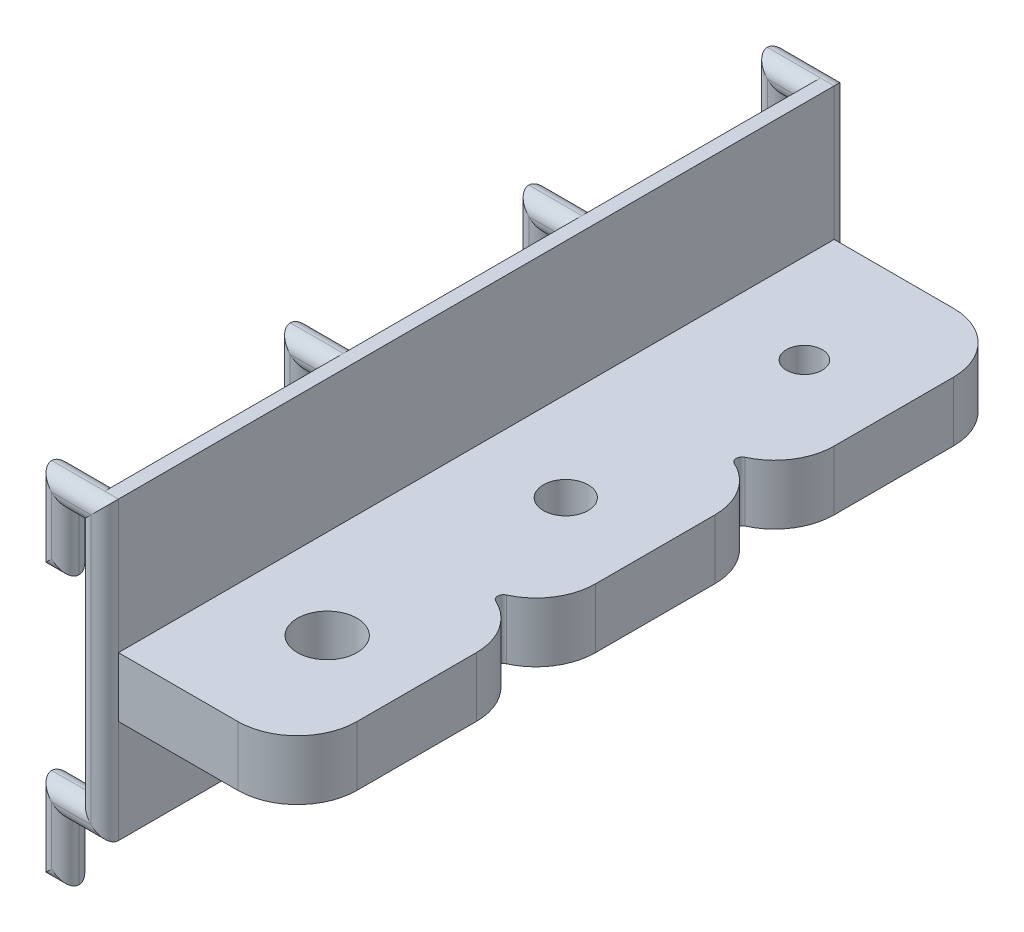
from build123d import *

# Parameters (mm, degrees)
EXTRU_MINCE1_DEPTH           = 2.3
CONG_1_R                     = 2.3
ESQUISSE2_W                  = 120
ESQUISSE2_H                  = 49.6
BOSS_EXTRU_1_DEPTH           = 2.3
R_P_TITION_START             = 117.7
R_P_TITION_LIN_AIRE1_DEPTH   = 4.6
R_P_TITION_START_2           = 37.7
R_P_TITION_LIN_AIRE1_2_DEPTH = 4.6
R_P_TITION_START_3           = 77.7
R_P_TITION_LIN_AIRE1_3_DEPTH = 4.6
CONG_2_R                     = 2.3
BOSS_EXTRU_2_START           = -30
BOSS_EXTRU_2_OUTLINE_R       = 5
BOSS_EXTRU_2_OUTLINE_R_2     = 3.75
BOSS_EXTRU_2_OUTLINE_R_3     = 3
BOSS_EXTRU_2_DEPTH           = 10


# Read off the part's stored shape, not the designer's step: Répétition linéaire1, Boss.-Extru.2
with BuildPart() as part:
    # Esquisse1 → Extru.-Mince1 (new, symmetric)
    with BuildSketch(Plane.XY):
        Polygon((-4.3, -57), (-4.3, -47.3), (2.3, -47.3), (2.3, 2.3), (-8.9, 2.3), (-8.9, -12), (-4.3, -12), (-4.3, -2.3), (-2.3, -2.3), (-2.3, -42.7), (-8.9, -42.7), (-8.9, -57), align=None)
    extrude(amount=EXTRU_MINCE1_DEPTH, both=True)

    # Congé1
    cong_1_edges = [part.edges().sort_by_distance(p)[0] for p in [
        (-6.6, -57, -2.3),
        (-4.3, -52.15, -2.3),
        (-1, -47.3, -2.3),
        (2.3, -22.5, -2.3),
        (-3.3, 2.3, -2.3),
        (-8.9, -4.85, -2.3),
        (-6.6, -12, -2.3),
        (-4.3, -7.15, -2.3),
        (-3.3, -2.3, -2.3),
        (-2.3, -22.5, -2.3),
        (-5.6, -42.7, -2.3),
        (-8.9, -49.85, -2.3),
        (-5.6, -42.7, 2.3),
        (-2.3, -22.5, 2.3),
        (-3.3, -2.3, 2.3),
        (-4.3, -7.15, 2.3),
        (-6.6, -12, 2.3),
        (-8.9, -4.85, 2.3),
        (-3.3, 2.3, 2.3),
        (2.3, -22.5, 2.3),
        (-1, -47.3, 2.3),
        (-4.3, -52.15, 2.3),
        (-6.6, -57, 2.3),
        (-8.9, -49.85, 2.3),
    ]]
    fillet(cong_1_edges, radius=CONG_1_R - 0.0001)  # a hair under: the kernel refuses the full size

    # Esquisse2 → Boss.-Extru.1 (add)
    with BuildSketch(Plane(origin=(0, 0, 0), x_dir=(0, 0, -1), z_dir=(1, 0, 0))):
        with Locations((-60, -22.5)):
            Rectangle(ESQUISSE2_W, ESQUISSE2_H)
    extrude(amount=BOSS_EXTRU_1_DEPTH)

    # Répétition linéaire1 outline → Répétition linéaire1 (add)
    with BuildSketch(Plane.XY.offset(R_P_TITION_START)):
        Polygon((-8.9, 2.3), (-8.9, -12), (-4.3, -12), (-4.3, -2.3), (-2.3, -2.3), (-2.3, -42.7), (-8.9, -42.7), (-8.9, -57), (-4.3, -57), (-4.3, -47.3), (2.3, -47.3), (2.3, 2.3), align=None)
    extrude(amount=R_P_TITION_LIN_AIRE1_DEPTH)

    # R_p_tition lin_aire1 2 outline → R_p_tition lin_aire1 2 (add)
    with BuildSketch(Plane.XY.offset(R_P_TITION_START_2)):
        Polygon((0, 2.3), (-8.9, 2.3), (-8.9, -12), (-4.3, -12), (-4.3, -2.3), (-2.3, -2.3), (-2.3, -42.7), (-8.9, -42.7), (-8.9, -57), (-4.3, -57), (-4.3, -47.3), (0, -47.3), align=None)
    extrude(amount=R_P_TITION_LIN_AIRE1_2_DEPTH)

    # R_p_tition lin_aire1 3 outline → R_p_tition lin_aire1 3 (add)
    with BuildSketch(Plane.XY.offset(R_P_TITION_START_3)):
        Polygon((0, 2.3), (-8.9, 2.3), (-8.9, -12), (-4.3, -12), (-4.3, -2.3), (-2.3, -2.3), (-2.3, -42.7), (-8.9, -42.7), (-8.9, -57), (-4.3, -57), (-4.3, -47.3), (0, -47.3), align=None)
    extrude(amount=R_P_TITION_LIN_AIRE1_3_DEPTH)

    # Congé2
    cong_2_edges = [part.edges().sort_by_distance(p)[0] for p in [
        (-2.15, -47.3, 82.3),
        (-4.45, 2.3, 82.3),
        (-4.3, -7.15, 82.3),
        (-3.3, -2.3, 82.3),
        (-2.3, -22.5, 82.3),
        (-5.6, -42.7, 82.3),
        (-8.9, -49.85, 82.3),
        (-4.45, 2.3, 77.7),
        (-2.15, -47.3, 77.7),
        (-4.3, -52.15, 77.7),
        (-6.6, -57, 77.7),
        (-6.6, -12, 77.7),
        (-8.9, -4.85, 77.7),
        (-8.9, -49.85, 77.7),
        (-6.6, -57, 82.3),
        (-4.3, -52.15, 82.3),
        (-8.9, -4.85, 82.3),
        (-6.6, -12, 82.3),
        (-4.3, -7.15, 77.7),
        (-3.3, -2.3, 77.7),
        (-2.3, -22.5, 77.7),
        (-5.6, -42.7, 77.7),
        (2.3, -22.5, 122.3),
        (-1, -47.3, 122.3),
        (-3.3, 2.3, 122.3),
        (-4.45, 2.3, 117.7),
        (-2.15, -47.3, 117.7),
        (-4.3, -52.15, 117.7),
        (-6.6, -57, 117.7),
        (-6.6, -12, 117.7),
        (-8.9, -4.85, 117.7),
        (-8.9, -49.85, 117.7),
        (-6.6, -57, 122.3),
        (-4.3, -52.15, 122.3),
        (-8.9, -4.85, 122.3),
        (-6.6, -12, 122.3),
        (-4.3, -7.15, 117.7),
        (-3.3, -2.3, 117.7),
        (-2.3, -22.5, 117.7),
        (-5.6, -42.7, 117.7),
        (-8.9, -49.85, 122.3),
        (-4.3, -7.15, 122.3),
        (-3.3, -2.3, 122.3),
        (-2.3, -22.5, 122.3),
        (-5.6, -42.7, 122.3),
        (-2.15, -47.3, 42.3),
        (-4.45, 2.3, 42.3),
        (-4.3, -7.15, 42.3),
        (-3.3, -2.3, 42.3),
        (-2.3, -22.5, 42.3),
        (-5.6, -42.7, 42.3),
        (-8.9, -49.85, 42.3),
        (-4.45, 2.3, 37.7),
        (-2.15, -47.3, 37.7),
        (-4.3, -52.15, 37.7),
        (-6.6, -57, 37.7),
        (-6.6, -12, 37.7),
        (-8.9, -4.85, 37.7),
        (-8.9, -49.85, 37.7),
        (-6.6, -57, 42.3),
        (-4.3, -52.15, 42.3),
        (-8.9, -4.85, 42.3),
        (-6.6, -12, 42.3),
        (-4.3, -7.15, 37.7),
        (-3.3, -2.3, 37.7),
        (-2.3, -22.5, 37.7),
        (-5.6, -42.7, 37.7),
    ]]
    fillet(cong_2_edges, radius=CONG_2_R - 0.0001)  # a hair under: the kernel refuses the full size

    # Boss.-Extru.2 outline → Boss.-Extru.2 (add)
    with BuildSketch(Plane(origin=(0, 0, 0), x_dir=(1, 0, 0), z_dir=(0, 1, 0)).offset(BOSS_EXTRU_2_START)):
        with BuildLine():
            Line((2.3, -120), (22.3, -120))
            ThreePointArc((22.3, -120), (29.371067812, -117.071067812), (32.3, -110))
            Line((32.3, -110), (32.3, -90))
            ThreePointArc((32.3, -90), (30.71604952, -84.599063926), (26.465977905, -80.909090909))
            ThreePointArc((26.465977905, -80.909090909), (25.882575695, -80), (26.465977905, -79.090909091))
            ThreePointArc((26.465977905, -79.090909091), (30.71604952, -75.400936074), (32.3, -70))
            Line((32.3, -70), (32.3, -50))
            ThreePointArc((32.3, -50), (30.71604952, -44.599063926), (26.465977905, -40.909090909))
            ThreePointArc((26.465977905, -40.909090909), (25.882575695, -40), (26.465977905, -39.090909091))
            ThreePointArc((26.465977905, -39.090909091), (30.71604952, -35.400936074), (32.3, -30))
            Line((32.3, -30), (32.3, -10))
            ThreePointArc((32.3, -10), (29.371067812, -2.928932188), (22.3, 0))
            Line((22.3, 0), (2.3, 0))
            Line((2.3, 0), (2.3, -120))
        make_face()
        with Locations((17.3, -100)):
            Circle(BOSS_EXTRU_2_OUTLINE_R, mode=Mode.SUBTRACT)
        with Locations((17.3, -60)):
            Circle(BOSS_EXTRU_2_OUTLINE_R_2, mode=Mode.SUBTRACT)
        with Locations((17.3, -20)):
            Circle(BOSS_EXTRU_2_OUTLINE_R_3, mode=Mode.SUBTRACT)
    extrude(amount=BOSS_EXTRU_2_DEPTH)


solid = part.part
